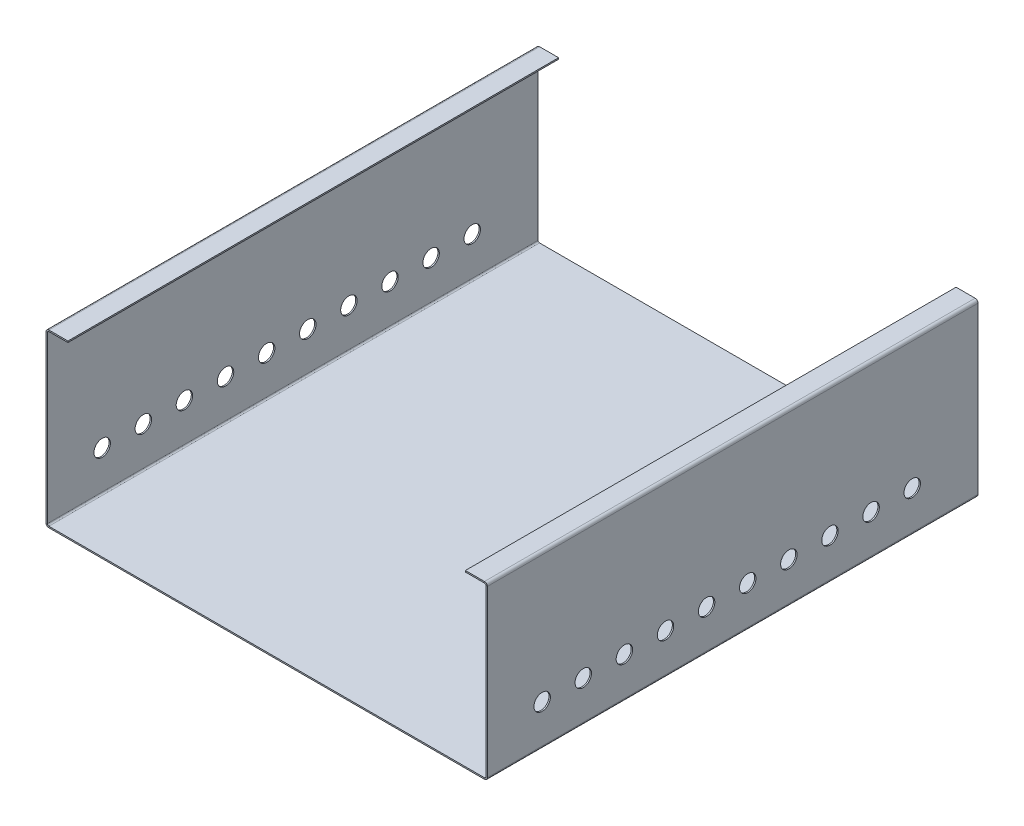
from build123d import *

# Parameters (mm, degrees)
SKETCH_1_W                         = 320
SKETCH_1_H                         = 358
SM_BASE_FLANGE_1_DEPTH             = 1
SM_EDGE_FLANGE_1_STRIP_W           = 6.2
SM_EDGE_FLANGE_1_STRIP_H           = 1
SM_EDGE_FLANGE_1_STRIP_CUT_DEPTH   = 358
SM_EDGE_FLANGE_1_STRIP_2_W         = 6.2
SM_EDGE_FLANGE_1_STRIP_2_H         = 1
SM_EDGE_FLANGE_1_STRIP_CUT_2_DEPTH = 358
SM_EDGE_FLANGE_1_DEPTH             = 358
SM_EDGE_FLANGE_1_BEND_DEPTH        = 358
SM_EDGE_FLANGE_2_STRIP_W           = 6.2
SM_EDGE_FLANGE_2_STRIP_H           = 1
SM_EDGE_FLANGE_2_STRIP_CUT_DEPTH   = 358
SM_EDGE_FLANGE_2_STRIP_2_W         = 6.2
SM_EDGE_FLANGE_2_STRIP_2_H         = 1
SM_EDGE_FLANGE_2_STRIP_CUT_2_DEPTH = 358
SM_EDGE_FLANGE_2_DEPTH             = 358
SM_EDGE_FLANGE_2_BEND_DEPTH        = 358
SKETCH_16_R                        = 6
CUT_EXTRUDE_1_DEPTH                = 334


# Sheet-metal steps are written as plain solids
with BuildPart() as part:
    # Sketch 1 → Базовая кромка1 (new body)
    with BuildSketch(Plane(origin=(0, 0, 0), x_dir=(1, 0, 0), z_dir=(0, 1, 0))):
        with Locations((97.50385107, -136.274394999)):
            Rectangle(SKETCH_1_W, SKETCH_1_H)
    extrude(amount=-SM_BASE_FLANGE_1_DEPTH)

    # Ребро-кромка1 strip (across the edge) → Ребро-кромка1 strip cut (cut)
    with BuildSketch(Plane(origin=(-62.49614893, 0, -42.725605001), x_dir=(1, 0, 0), z_dir=(0, 0, 1))):
        with Locations((-2, -0.5)):
            Rectangle(SM_EDGE_FLANGE_1_STRIP_W, SM_EDGE_FLANGE_1_STRIP_H)
    extrude(amount=SM_EDGE_FLANGE_1_STRIP_CUT_DEPTH, mode=Mode.SUBTRACT)

    # Ребро-кромка1 strip 2 (across the edge) → Ребро-кромка1 strip cut 2 (cut)
    with BuildSketch(Plane(origin=(257.50385107, 0, 315.274394999), x_dir=(-1, 0, 0), z_dir=(0, 0, -1))):
        with Locations((-2, -0.5)):
            Rectangle(SM_EDGE_FLANGE_1_STRIP_2_W, SM_EDGE_FLANGE_1_STRIP_2_H)
    extrude(amount=SM_EDGE_FLANGE_1_STRIP_CUT_2_DEPTH, mode=Mode.SUBTRACT)

    # Ребро-кромка1 section (across the edge) → Ребро-кромка1 (add)
    with BuildSketch(Plane(origin=(-62.49614893, 0, -42.725605001), x_dir=(1, 0, 0), z_dir=(0, 0, 1))):
        with BuildLine():
            Line((-1, 1.1), (-1, 123))
            Line((-1, 123), (0, 123))
            Line((0, 123), (0, 1.1))
            ThreePointArc((0, 1.1), (0.322182541, 0.322182541), (1.1, 0))
            Line((1.1, 0), (1.1, -1))
            ThreePointArc((1.1, -1), (-0.38492424, -0.38492424), (-1, 1.1))
        make_face()
    extrude(amount=SM_EDGE_FLANGE_1_DEPTH)

    # Ребро-кромка1 section 2 (across the edge) → Ребро-кромка1 bend (add)
    with BuildSketch(Plane(origin=(257.50385107, 0, 315.274394999), x_dir=(-1, 0, 0), z_dir=(0, 0, -1))):
        with BuildLine():
            Line((-1, 1.1), (-1, 123))
            Line((-1, 123), (0, 123))
            Line((0, 123), (0, 1.1))
            ThreePointArc((0, 1.1), (0.322182541, 0.322182541), (1.1, 0))
            Line((1.1, 0), (1.1, -1))
            ThreePointArc((1.1, -1), (-0.38492424, -0.38492424), (-1, 1.1))
        make_face()
    extrude(amount=SM_EDGE_FLANGE_1_BEND_DEPTH)

    # Ребро-кромка2 strip (across the edge) → Ребро-кромка2 strip cut (cut)
    with BuildSketch(Plane(origin=(-62.49614893, 123, -42.725605001), x_dir=(0, -1, 0), z_dir=(0, 0, 1))):
        with Locations((-2, -0.5)):
            Rectangle(SM_EDGE_FLANGE_2_STRIP_W, SM_EDGE_FLANGE_2_STRIP_H)
    extrude(amount=SM_EDGE_FLANGE_2_STRIP_CUT_DEPTH, mode=Mode.SUBTRACT)

    # Ребро-кромка2 strip 2 (across the edge) → Ребро-кромка2 strip cut 2 (cut)
    with BuildSketch(Plane(origin=(257.50385107, 123, 315.274394999), x_dir=(0, -1, 0), z_dir=(0, 0, -1))):
        with Locations((-2, -0.5)):
            Rectangle(SM_EDGE_FLANGE_2_STRIP_2_W, SM_EDGE_FLANGE_2_STRIP_2_H)
    extrude(amount=SM_EDGE_FLANGE_2_STRIP_CUT_2_DEPTH, mode=Mode.SUBTRACT)

    # Ребро-кромка2 section (across the edge) → Ребро-кромка2 (add)
    with BuildSketch(Plane(origin=(-62.49614893, 123, -42.725605001), x_dir=(0, -1, 0), z_dir=(0, 0, 1))):
        with BuildLine():
            Line((-1, 1.1), (-1, 15))
            Line((-1, 15), (0, 15))
            Line((0, 15), (0, 1.1))
            ThreePointArc((0, 1.1), (0.322182541, 0.322182541), (1.1, 0))
            Line((1.1, 0), (1.1, -1))
            ThreePointArc((1.1, -1), (-0.38492424, -0.38492424), (-1, 1.1))
        make_face()
    extrude(amount=SM_EDGE_FLANGE_2_DEPTH)

    # Ребро-кромка2 section 2 (across the edge) → Ребро-кромка2 bend (add)
    with BuildSketch(Plane(origin=(257.50385107, 123, 315.274394999), x_dir=(0, -1, 0), z_dir=(0, 0, -1))):
        with BuildLine():
            Line((-1, 1.1), (-1, 15))
            Line((-1, 15), (0, 15))
            Line((0, 15), (0, 1.1))
            ThreePointArc((0, 1.1), (0.322182541, 0.322182541), (1.1, 0))
            Line((1.1, 0), (1.1, -1))
            ThreePointArc((1.1, -1), (-0.38492424, -0.38492424), (-1, 1.1))
        make_face()
    extrude(amount=SM_EDGE_FLANGE_2_BEND_DEPTH)

    # Эскиз16 → Вырез-Вытянуть1 (cut)
    with BuildSketch(Plane(origin=(258.50385107, 0, 0), x_dir=(0, 0, -1), z_dir=(1, 0, 0))):
        with Locations(Location((-275.274394999, 29, 0), (0, 0, 90))):
            Circle(SKETCH_16_R)
        with Locations(Location((-245.274394999, 29, 0), (0, 0, 90))):
            Circle(SKETCH_16_R)
        with Locations(Location((-215.274394999, 29, 0), (0, 0, 90))):
            Circle(SKETCH_16_R)
        with Locations(Location((-185.274394999, 29, 0), (0, 0, 90))):
            Circle(SKETCH_16_R)
        with Locations(Location((-155.274394999, 29, 0), (0, 0, 90))):
            Circle(SKETCH_16_R)
        with Locations(Location((-125.274394999, 29, 0), (0, 0, 90))):
            Circle(SKETCH_16_R)
        with Locations(Location((-95.274394999, 29, 0), (0, 0, 90))):
            Circle(SKETCH_16_R)
        with Locations(Location((-65.274394999, 29, 0), (0, 0, 90))):
            Circle(SKETCH_16_R)
        with Locations(Location((-35.274394999, 29, 0), (0, 0, 90))):
            Circle(SKETCH_16_R)
        with Locations(Location((-5.274394999, 29, 0), (0, 0, 90))):
            Circle(SKETCH_16_R)
    extrude(amount=-CUT_EXTRUDE_1_DEPTH, mode=Mode.SUBTRACT)


solid = part.part
